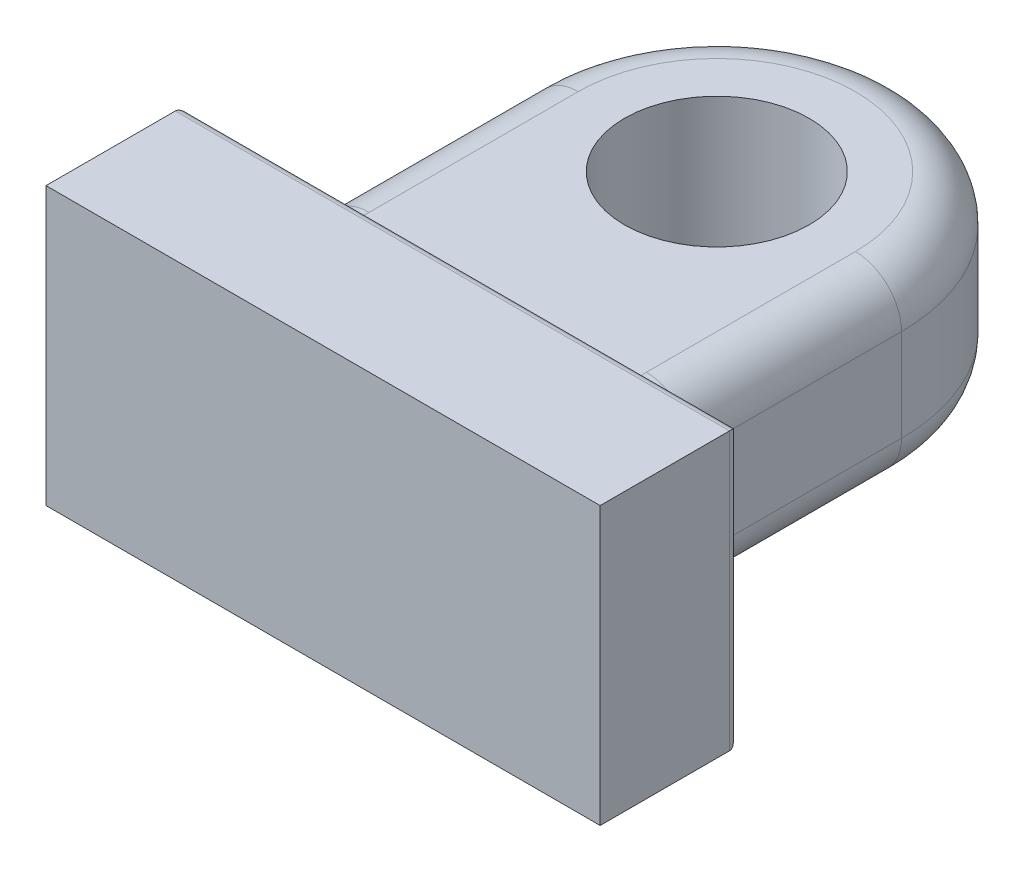
from build123d import *

# Parameters (mm, degrees)
SKETCH3_W           = 60
SKETCH3_H           = 30
BOSS_EXTRUDE1_DEPTH = 15
SKETCH4_R           = 10
BOSS_EXTRUDE2_DEPTH = 10
FILLET1_R           = 5
FILLET2_R           = 5
FILLET3_R           = 1


with BuildPart() as part:
    # Sketch3 → Boss-Extrude1 (new body)
    with BuildSketch(Plane.XY):
        with Locations((30, -15)):
            Rectangle(SKETCH3_W, SKETCH3_H)
    extrude(amount=BOSS_EXTRUDE1_DEPTH)

    # Sketch4 → Boss-Extrude2 (add, symmetric)
    with BuildSketch(Plane(origin=(0, -15, 0), x_dir=(1, 0, 0), z_dir=(0, 1, 0))):
        with BuildLine():
            Line((10, 27.631533215), (10, 0))
            Line((10, 0), (50, 0))
            Line((50, 0), (50, 27.631533215))
            ThreePointArc((50, 27.631533215), (30, 47.631533215), (10, 27.631533215))
        make_face()
        with Locations(Location((30, 27.631533215, 0), (0, 0, 270))):
            Circle(SKETCH4_R, mode=Mode.SUBTRACT)
    extrude(amount=BOSS_EXTRUDE2_DEPTH, both=True)

    # Fillet1
    fillet1_edges = [part.edges().sort_by_distance(p)[0] for p in [
        (10, -15, 0),
        (50, -15, 0),
    ]]
    fillet(fillet1_edges, radius=FILLET1_R)

    # Fillet2
    # the kernel refuses this fillet: 5 mm, written as the material it takes off along each edge
    with BuildSketch(Plane(origin=(30, -5, -27.631533215), x_dir=(1, 0, 0), z_dir=(0, 0, 1))) as fillet2_piece_1:
        with BuildLine():
            CenterArc((20 - FILLET2_R, -FILLET2_R), FILLET2_R, 0, 90)
            Line((20 - FILLET2_R, 0), (20, 0))
            Line((20, 0), (20, -FILLET2_R))
        make_face()
    revolve(axis=Axis((30, -5, -27.631533215), (0, 1, 0)), revolution_arc=180, mode=Mode.SUBTRACT)
    with BuildSketch(Plane(origin=(10, -5, -27.631533215), x_dir=(0, -1, 0), z_dir=(0, 0, 1)), Plane(origin=(50, -5, -5), x_dir=(0, -1, 0), z_dir=(0, 0, -1))) as fillet2_piece_2:
        with BuildLine():
            CenterArc((FILLET2_R, FILLET2_R), FILLET2_R, 180, 90)
            Line((0, FILLET2_R), (0, 0))
            Line((0, 0), (FILLET2_R, 0))
        make_face()
    extrude(amount=22.631533215, mode=Mode.SUBTRACT)
    with BuildSketch(Plane(origin=(30, -25, -27.631533215), x_dir=(1, 0, 0), z_dir=(0, 0, 1))) as fillet2_piece_3:
        with BuildLine():
            CenterArc((20 - FILLET2_R, FILLET2_R), FILLET2_R, 270, 90)
            Line((20 - FILLET2_R, 0), (20, 0))
            Line((20, 0), (20, FILLET2_R))
        make_face()
    revolve(axis=Axis((30, -25, -27.631533215), (0, 1, 0)), revolution_arc=180, mode=Mode.SUBTRACT)
    with BuildSketch(Plane(origin=(10, -25, -27.631533215), x_dir=(0, 1, 0), z_dir=(0, 0, 1)), Plane(origin=(50, -25, -5), x_dir=(0, 1, 0), z_dir=(0, 0, -1))) as fillet2_piece_4:
        with BuildLine():
            CenterArc((FILLET2_R, -FILLET2_R), FILLET2_R, 90, 90)
            Line((0, -FILLET2_R), (0, 0))
            Line((0, 0), (FILLET2_R, 0))
        make_face()
    extrude(amount=22.631533215, mode=Mode.SUBTRACT)
    with BuildSketch(Plane(origin=(55, -25, -5), x_dir=(0.5976672776328272, 0, -0.8017442392976484), z_dir=(-0.8017442392976484, 0, -0.5976672776328272))) as fillet2_piece_5_section:
        with BuildLine():
            CenterArc((5 + FILLET2_R, -FILLET2_R), FILLET2_R, 90, 90)
            Line((5 + FILLET2_R, 0), (5, 0))
            Line((5, 0), (5, -FILLET2_R))
        make_face()
    fillet2_piece_5 = revolve(axis=Axis((55, -25, -5), (0, -1, 0)), revolution_arc=233.296989237, mode=Mode.PRIVATE)
    fillet2_piece_5 = split(fillet2_piece_5, bisect_by=Plane(origin=(51.250305352, -23.441858441, 0), z_dir=(0, 0, -1)), keep=Keep.TOP, mode=Mode.PRIVATE)
    add(fillet2_piece_5, mode=Mode.SUBTRACT)
    with BuildSketch(Plane(origin=(55, -5, -5), x_dir=(0.5976672776328272, 0, -0.8017442392976484), z_dir=(-0.8017442392976484, 0, -0.5976672776328272))) as fillet2_piece_6_section:
        with BuildLine():
            CenterArc((5 + FILLET2_R, FILLET2_R), FILLET2_R, 180, 90)
            Line((5, FILLET2_R), (5, 0))
            Line((5, 0), (5 + FILLET2_R, 0))
        make_face()
    fillet2_piece_6 = revolve(axis=Axis((55, -5, -5), (0, -1, 0)), revolution_arc=233.296989237, mode=Mode.PRIVATE)
    fillet2_piece_6 = split(fillet2_piece_6, bisect_by=Plane(origin=(51.250305352, -6.558141559, 0), z_dir=(0, 0, -1)), keep=Keep.TOP, mode=Mode.PRIVATE)
    add(fillet2_piece_6, mode=Mode.SUBTRACT)
    with BuildSketch(Plane(origin=(5, -25, -5), x_dir=(-0.5976672776328278, 0, -0.801744239297648), z_dir=(0.801744239297648, 0, -0.5976672776328278))) as fillet2_piece_7_section:
        with BuildLine():
            CenterArc((5 + FILLET2_R, FILLET2_R), FILLET2_R, 180, 90)
            Line((5 + FILLET2_R, 0), (5, 0))
            Line((5, 0), (5, FILLET2_R))
        make_face()
    fillet2_piece_7 = revolve(axis=Axis((5, -25, -5), (0, 1, 0)), revolution_arc=233.296989237, mode=Mode.PRIVATE)
    fillet2_piece_7 = split(fillet2_piece_7, bisect_by=Plane(origin=(8.749694574, -23.441858005, 0), z_dir=(0, 0, -1)), keep=Keep.TOP, mode=Mode.PRIVATE)
    add(fillet2_piece_7, mode=Mode.SUBTRACT)
    with BuildSketch(Plane(origin=(5, -5, -5), x_dir=(-0.5976672776328278, 0, -0.801744239297648), z_dir=(0.801744239297648, 0, -0.5976672776328278))) as fillet2_piece_8_section:
        with BuildLine():
            CenterArc((5 + FILLET2_R, -FILLET2_R), FILLET2_R, 90, 90)
            Line((5 + FILLET2_R, 0), (5, 0))
            Line((5, 0), (5, -FILLET2_R))
        make_face()
    fillet2_piece_8 = revolve(axis=Axis((5, -5, -5), (0, 1, 0)), revolution_arc=233.296989237, mode=Mode.PRIVATE)
    fillet2_piece_8 = split(fillet2_piece_8, bisect_by=Plane(origin=(8.749694574, -6.558141995, 0), z_dir=(0, 0, -1)), keep=Keep.TOP, mode=Mode.PRIVATE)
    add(fillet2_piece_8, mode=Mode.SUBTRACT)

    # Fillet3
    fillet3_edges = [part.edges().sort_by_distance(p)[0] for p in [
        (30, 0, 0),
        (60, -15, 0),
        (30, -30, 0),
        (30, -25, 0),
        (0, -15, 0),
        (30, -5, 0),
        (51.140144071, -23.381125805, 0),
        (8.859855929, -23.381125805, 0),
        (51.140144071, -6.618874195, 0),
        (8.859855929, -6.618874195, 0),
    ]]
    fillet(fillet3_edges, radius=FILLET3_R)


solid = part.part
